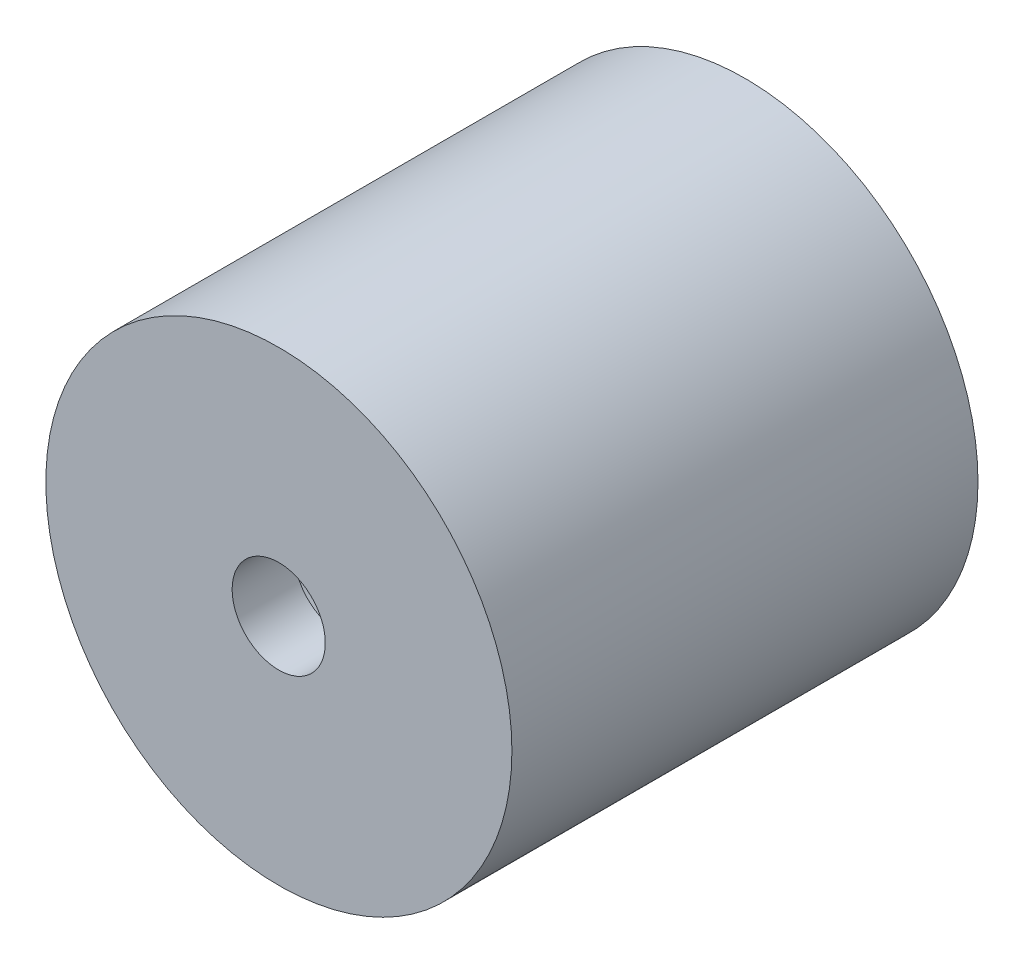
from build123d import *

# Parameters (mm, degrees)
SKETCH1_R           = 15
BOSS_EXTRUDE1_DEPTH = 30
SHELL13_T           = -4
SKETCH3_R           = 3
CUT_EXTRUDE2_DEPTH  = 4


with BuildPart() as part:
    # Sketch1 → Boss-Extrude1 (new body)
    with BuildSketch(Plane.XY):
        Circle(SKETCH1_R)
    extrude(amount=BOSS_EXTRUDE1_DEPTH)

    # Shell13
    shell13_openings = [part.faces().sort_by_distance(p)[0] for p in [
        (0, 0, 0),
    ]]
    offset(amount=SHELL13_T, openings=shell13_openings, kind=Kind.INTERSECTION)

    # Sketch3 → Cut-Extrude2 (cut)
    with BuildSketch(Plane(origin=(0, 0, 26), x_dir=(-1, 0, 0), z_dir=(0, 0, -1))):
        with Locations((0.010259738, 0.007572697)):
            Circle(SKETCH3_R)
    extrude(amount=-CUT_EXTRUDE2_DEPTH, mode=Mode.SUBTRACT)


solid = part.part
